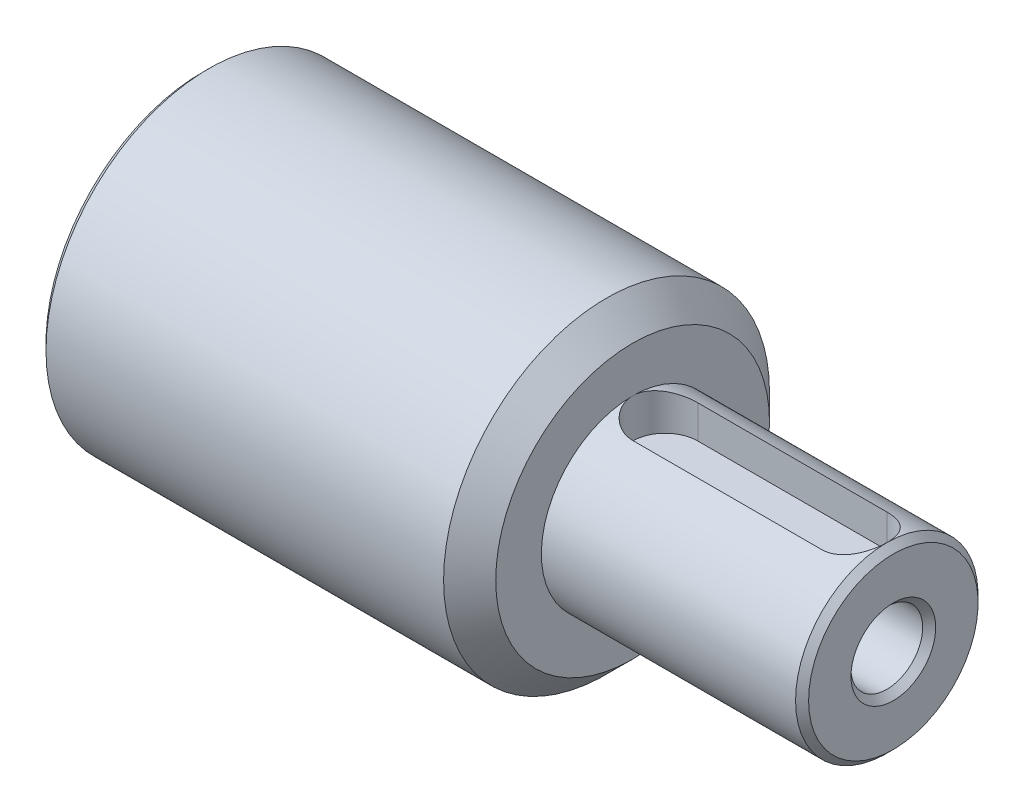
from build123d import *

# Parameters (mm, degrees)
SKETCH_2_W          = 5
SKETCH_2_H          = 9
CUT_EXTRUDE_1_DEPTH = 26
CHAMFER_1_SIZE      = 2
CHAMFER_2_SIZE      = 0.5
FILLET_1_R          = 1
CUT_EXTRUDE_2_DEPTH = 3


with BuildPart() as part:
    # 草图1 → 旋转1 (revolve)
    with BuildSketch(Plane.XY):
        Polygon((0, 7), (0, 12.5), (33, 12.5), (33, 7), (53, 7), (53, 2.75), (28, 2.75), (28, 7), align=None)
    revolve(axis=Axis((0, 0, 0), (1, 0, 0)))

    # 草图2 → 切除-拉伸1 (cut)
    with BuildSketch(Plane.ZY):
        with Locations((0, 4.5)):
            Rectangle(SKETCH_2_W, SKETCH_2_H)
    extrude(amount=-CUT_EXTRUDE_1_DEPTH, mode=Mode.SUBTRACT)

    # 倒角1
    chamfer_1_edges = [part.edges().sort_by_distance(p)[0] for p in [
        (33, -12.5, 0),
    ]]
    chamfer(chamfer_1_edges, length=CHAMFER_1_SIZE)

    # 倒角2
    chamfer_2_edges = [part.edges().sort_by_distance(p)[0] for p in [
        (53, -7, 0),
        (0, -7, 0),
        (53, -2.75, 0),
        (0, -12.5, 0),
    ]]
    chamfer(chamfer_2_edges, length=CHAMFER_2_SIZE)

    # 圆角1
    fillet_1_edges = [part.edges().sort_by_distance(p)[0] for p in [
        (28, -7, 0),
    ]]
    fillet(fillet_1_edges, radius=FILLET_1_R)

    # 草图3 → 切除-拉伸2 (cut)
    with BuildSketch(Plane(origin=(0, 7, 0), x_dir=(1, 0, 0), z_dir=(0, 1, 0))):
        with BuildLine():
            Line((35.5, 2.5), (50, 2.5))
            ThreePointArc((50, 2.5), (52.5, 0), (50, -2.5))
            Line((50, -2.5), (35.5, -2.5))
            ThreePointArc((35.5, -2.5), (33, 0), (35.5, 2.5))
        make_face()
    extrude(amount=-CUT_EXTRUDE_2_DEPTH, mode=Mode.SUBTRACT)


solid = part.part
